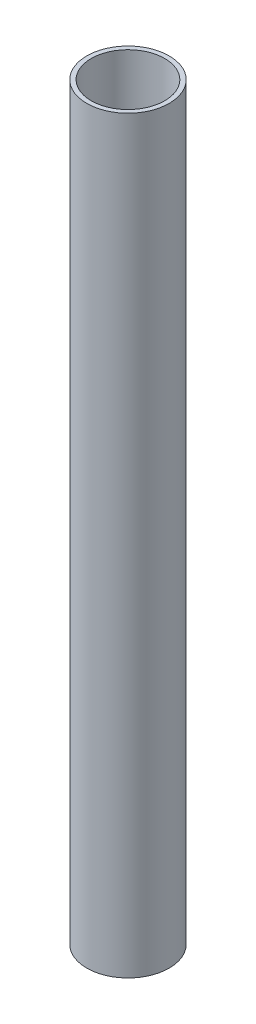
from build123d import *

# Parameters (mm, degrees)
SKETCH_1_R      = 55
SKETCH_1_R_2    = 49
EXTRUDE_1_DEPTH = 1000


with BuildPart() as part:
    # Эскиз1 → Бобышка-Вытянуть1 (new body)
    with BuildSketch(Plane(origin=(0, 0, 0), x_dir=(1, 0, 0), z_dir=(0, 1, 0))):
        Circle(SKETCH_1_R)
        Circle(SKETCH_1_R_2, mode=Mode.SUBTRACT)
    extrude(amount=EXTRUDE_1_DEPTH)


solid = part.part
